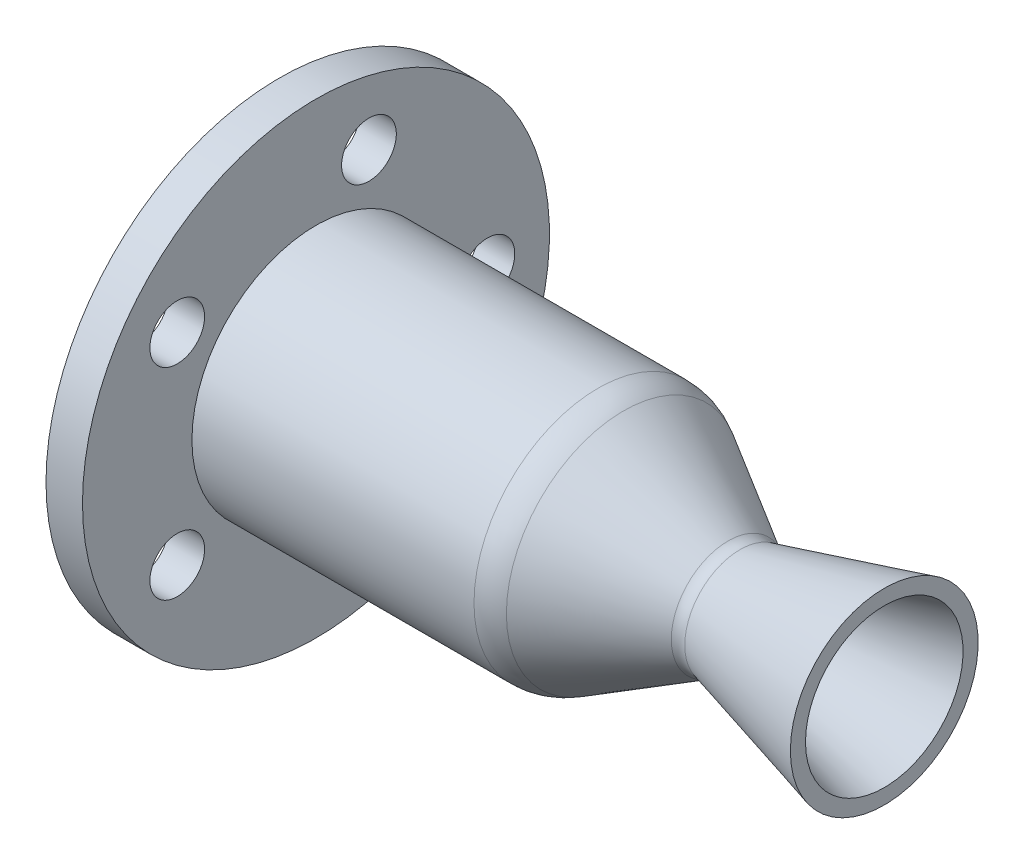
from build123d import *

# Parameters (mm, degrees)
SKETCH2_R          = 9.525
CUT_EXTRUDE1_DEPTH = 240.879490342


with BuildPart() as part:
    # Sketch1 → Revolve1 (revolve)
    with BuildSketch(Plane.XY):
        with BuildLine():
            Line((0, 38.1), (110.897045256, 38.1))
            ThreePointArc((110.897045256, 38.1), (114.184047129, 37.667257994), (117.247045256, 36.398522628))
            Line((117.247045256, 36.398522628), (153.648338424, 15.382226219))
            ThreePointArc((153.648338424, 15.382226219), (157.542961832, 14.060179716), (161.647049978, 14.329175865))
            Line((161.647049978, 14.329175865), (210.545228126, 27.431403211))
            Line((210.545228126, 27.431403211), (210.545228126, 32.690606208))
            Line((210.545228126, 32.690606208), (160.332249229, 19.236079063))
            ThreePointArc((160.332249229, 19.236079063), (158.206034888, 19.096719612), (156.188338424, 19.78163527))
            Line((156.188338424, 19.78163527), (119.787045256, 40.797931679))
            ThreePointArc((119.787045256, 40.797931679), (115.498847878, 42.574161191), (110.897045256, 43.18))
            Line((110.897045256, 43.18), (12.7, 43.18))
            Line((12.7, 43.18), (12.7, 81.28))
            Line((12.7, 81.28), (0, 81.28))
            Line((0, 81.28), (0, 43.18))
            Line((0, 43.18), (0, 38.1))
        make_face()
    revolve(axis=Axis((0, 0, 0), (1, 0, 0)))

    # Sketch2 → Cut-Extrude1 (cut, through all)
    with BuildSketch(Plane.ZY):
        with Locations((-59.69, 0)):
            Circle(SKETCH2_R)
        with Locations((-18.445224394, 56.768563458)):
            Circle(SKETCH2_R)
        with Locations((48.290224394, 35.084901709)):
            Circle(SKETCH2_R)
        with Locations((48.290224394, -35.084901709)):
            Circle(SKETCH2_R)
        with Locations((-18.445224394, -56.768563458)):
            Circle(SKETCH2_R)
    extrude(amount=-CUT_EXTRUDE1_DEPTH, mode=Mode.SUBTRACT)


solid = part.part
